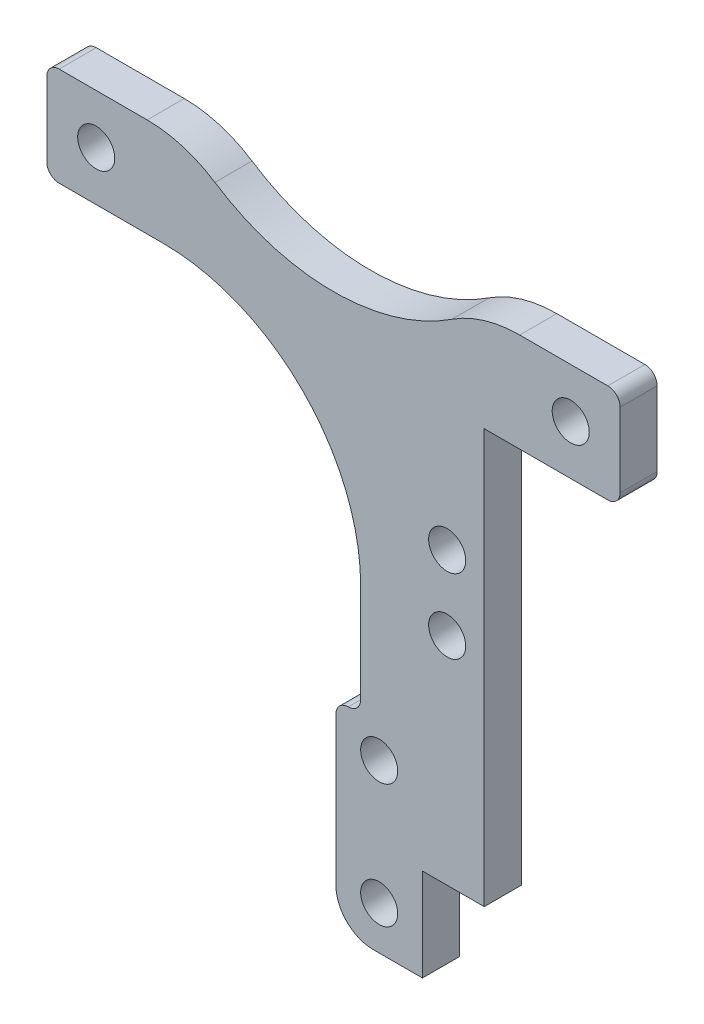
from build123d import *

# Parameters (mm, degrees)
SKETCH_1_R          = 1.5
EXTRUDE_1_DEPTH     = 3
FILLET_1_R          = 1
FILLET_4_R          = 16
SKETCH_2_R          = 17.5
CUT_EXTRUDE_1_DEPTH = 3
FILLET_5_R          = 10
SKETCH_3_W          = 10
SKETCH_3_H          = 7
CUT_EXTRUDE_2_DEPTH = 10
SKETCH_4_W          = 7
SKETCH_4_H          = 1
EXTRUDE_2_DEPTH     = 3
FILLET_7_R          = 3
SKETCH_5_R          = 1.5
CUT_EXTRUDE_3_DEPTH = 10


with BuildPart() as part:
    # 草图1 → 凸台-拉伸1 (new body)
    with BuildSketch(Plane.XY):
        Polygon((0, 0), (0, 3.5), (-5, 3.5), (-5, 13.5), (0, 13.5), (0, 47), (11, 47), (11, 55), (-35.4, 55), (-35.4, 47), (-10, 47), (-10, 22), (-12, 22), (-12, 7), (-10, 7), (-10, 0), align=None)
        with Locations((7, 51)):
            Circle(SKETCH_1_R, mode=Mode.SUBTRACT)
        with Locations((-31.4, 51)):
            Circle(SKETCH_1_R, mode=Mode.SUBTRACT)
        with Locations((-8.5, 19.5)):
            Circle(SKETCH_1_R, mode=Mode.SUBTRACT)
        with Locations((-8.5, 9.5)):
            Circle(SKETCH_1_R, mode=Mode.SUBTRACT)
    extrude(amount=EXTRUDE_1_DEPTH)

    # 圆角1
    fillet_1_edges = [part.edges().sort_by_distance(p)[0] for p in [
        (11, 55, 1.5),
        (11, 47, 1.5),
        (-35.4, 47, 1.5),
        (-35.4, 55, 1.5),
        (-10, 22, 1.5),
        (-12, 22, 1.5),
    ]]
    fillet(fillet_1_edges, radius=FILLET_1_R - 0.0001)  # a hair under: the kernel refuses the full size

    # 圆角4
    fillet_4_edges = [part.edges().sort_by_distance(p)[0] for p in [
        (-10, 47, 1.5),
    ]]
    fillet(fillet_4_edges, radius=FILLET_4_R)

    # 草图2 → 切除-拉伸1 (cut)
    with BuildSketch(Plane.XY.offset(3)):
        with Locations((-12.2, 68)):
            Circle(SKETCH_2_R)
    extrude(amount=-CUT_EXTRUDE_1_DEPTH, mode=Mode.SUBTRACT)

    # 圆角5
    fillet_5_edges = [part.edges().sort_by_distance(p)[0] for p in [
        (-23.915374514, 55, 1.5),
        (-0.484625486, 55, 1.5),
    ]]
    fillet(fillet_5_edges, radius=FILLET_5_R)

    # 草图3 → 切除-拉伸2 (cut)
    with BuildSketch(Plane(origin=(0, 0, 0), x_dir=(-1, 0, 0), z_dir=(0, 0, -1))):
        with Locations((5, 3.5)):
            Rectangle(SKETCH_3_W, SKETCH_3_H)
    extrude(amount=-CUT_EXTRUDE_2_DEPTH, mode=Mode.SUBTRACT)

    # 草图4 → 凸台-拉伸2 (add)
    with BuildSketch(Plane(origin=(0, 0, 0), x_dir=(-1, 0, 0), z_dir=(0, 0, -1))):
        with Locations((8.5, 6.5)):
            Rectangle(SKETCH_4_W, SKETCH_4_H)
    extrude(amount=-EXTRUDE_2_DEPTH)

    # 圆角7
    fillet_7_edges = [part.edges().sort_by_distance(p)[0] for p in [
        (-12, 6, 1.5),
    ]]
    fillet(fillet_7_edges, radius=FILLET_7_R)

    # 草图5 → 切除-拉伸3 (cut)
    with BuildSketch(Plane.XY.offset(3)):
        with Locations((-3, 31)):
            Circle(SKETCH_5_R)
        with Locations((-3, 37)):
            Circle(SKETCH_5_R)
    extrude(amount=-CUT_EXTRUDE_3_DEPTH, mode=Mode.SUBTRACT)


solid = part.part
